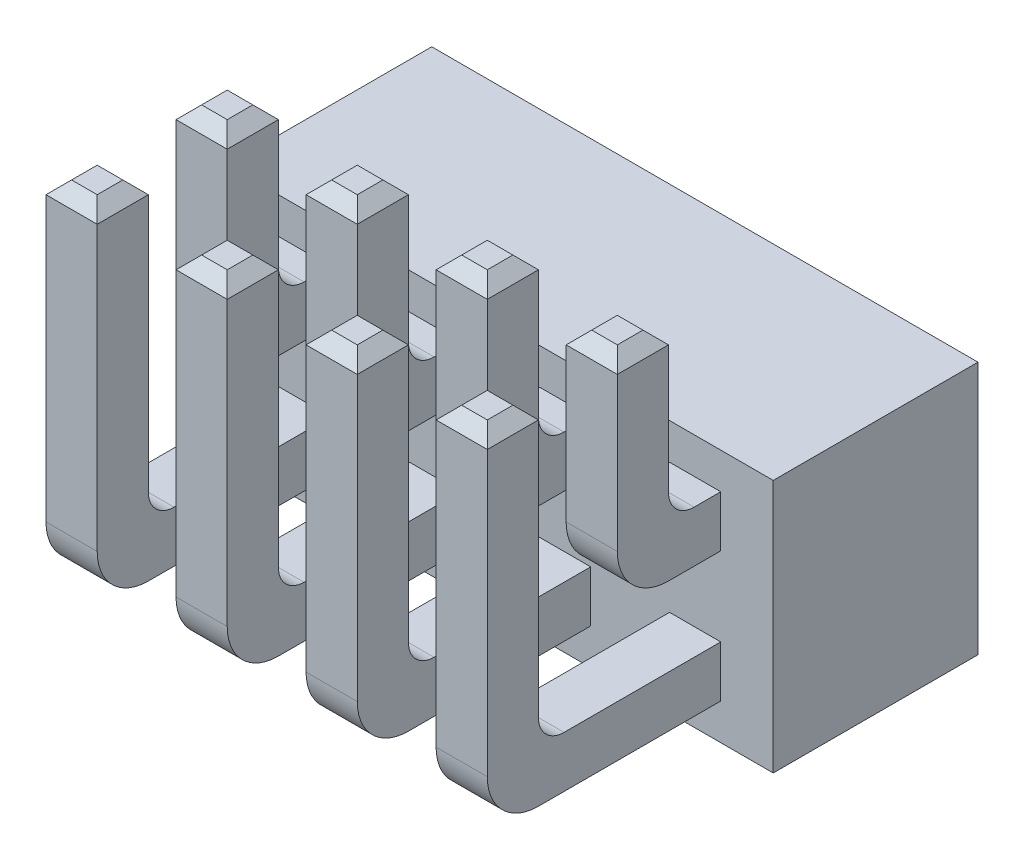
from build123d import *

# Parameters (mm, degrees)
SKETCH1_W           = 10.67
SKETCH1_H           = 4.95
BOSS_EXTRUDE1_DEPTH = 4
SKETCH3_W           = 1.382324252
SKETCH3_H           = 1.382324252
CUT_EXTRUDE1_DEPTH  = 3
BOSS_EXTRUDE2_START = 3.31
BOSS_EXTRUDE2_DEPTH = 1
LPATTERN1_COUNT     = 4
LPATTERN1_PITCH     = 2.54
CHAMFER1_SIZE       = 0.25


with BuildPart() as part:
    # Sketch1 → Boss-Extrude1 (new body)
    with BuildSketch(Plane.XY):
        Rectangle(SKETCH1_W, SKETCH1_H)
    extrude(amount=BOSS_EXTRUDE1_DEPTH)

    # Sketch3 → Cut-Extrude1 (cut)
    with BuildSketch(Plane(origin=(0, 0, 0), x_dir=(-1, 0, 0), z_dir=(0, 0, -1))):
        with Locations((-1.27, 1.27)):
            Rectangle(SKETCH3_W, SKETCH3_H)
        with Locations((-3.81, 1.27)):
            Rectangle(SKETCH3_W, SKETCH3_H)
        with Locations((1.27, 1.27)):
            Rectangle(SKETCH3_W, SKETCH3_H)
        with Locations((3.81, 1.27)):
            Rectangle(SKETCH3_W, SKETCH3_H)
        with Locations((-1.27, -1.27)):
            Rectangle(SKETCH3_W, SKETCH3_H)
        with Locations((1.27, -1.27)):
            Rectangle(SKETCH3_W, SKETCH3_H)
        with Locations((3.81, -1.27)):
            Rectangle(SKETCH3_W, SKETCH3_H)
        with Locations((-3.81, -1.27)):
            Rectangle(SKETCH3_W, SKETCH3_H)
    extrude(amount=-CUT_EXTRUDE1_DEPTH, mode=Mode.SUBTRACT)

    # Sketch4 → Boss-Extrude2 (add)
    with BuildSketch(Plane(origin=(0, 0, 0), x_dir=(0, 0, -1), z_dir=(1, 0, 0)).offset(BOSS_EXTRUDE2_START)):
        with BuildLine():
            Line((-4, 0.77), (-5.02, 0.77))
            ThreePointArc((-5.02, 0.77), (-5.727106781, 1.062893219), (-6.02, 1.77))
            Line((-6.02, 1.77), (-6.02, 5.015))
            Line((-6.02, 5.015), (-5.02, 5.015))
            Line((-5.02, 5.015), (-5.02, 2.27))
            ThreePointArc((-5.02, 2.27), (-4.873553391, 1.916446609), (-4.52, 1.77))
            Line((-4.52, 1.77), (-4, 1.77))
            Line((-4, 1.77), (-4, 0.77))
        make_face()
        with BuildLine():
            Line((-4, -1.77), (-7.56, -1.77))
            ThreePointArc((-7.56, -1.77), (-8.267106781, -1.477106781), (-8.56, -0.77))
            Line((-8.56, -0.77), (-8.56, 5.015))
            Line((-8.56, 5.015), (-7.56, 5.015))
            Line((-7.56, 5.015), (-7.56, -0.27))
            ThreePointArc((-7.56, -0.27), (-7.413553391, -0.623553391), (-7.06, -0.77))
            Line((-7.06, -0.77), (-4, -0.77))
            Line((-4, -0.77), (-4, -1.77))
        make_face()
    boss_extrude2 = extrude(amount=BOSS_EXTRUDE2_DEPTH)

    # LPattern1: Boss-Extrude2 ×4
    with Locations(*[(-i * LPATTERN1_PITCH, 0, 0) for i in range(1, LPATTERN1_COUNT)]):
        add(boss_extrude2)

    # Chamfer1
    chamfer1_edges = [part.edges().sort_by_distance(p)[0] for p in [
        (-3.81, 5.015, 7.56),
        (-3.31, 5.015, 8.06),
        (-3.81, 5.015, 8.56),
        (-4.31, 5.015, 8.06),
        (-1.27, 5.015, 7.56),
        (-0.77, 5.015, 8.06),
        (-1.27, 5.015, 8.56),
        (-1.77, 5.015, 8.06),
        (1.27, 5.015, 7.56),
        (1.77, 5.015, 8.06),
        (1.27, 5.015, 8.56),
        (0.77, 5.015, 8.06),
        (3.81, 5.015, 7.56),
        (4.31, 5.015, 8.06),
        (3.81, 5.015, 8.56),
        (3.31, 5.015, 8.06),
        (3.81, 5.015, 5.02),
        (4.31, 5.015, 5.52),
        (3.81, 5.015, 6.02),
        (3.31, 5.015, 5.52),
        (1.27, 5.015, 5.02),
        (1.77, 5.015, 5.52),
        (1.27, 5.015, 6.02),
        (0.77, 5.015, 5.52),
        (-1.27, 5.015, 5.02),
        (-0.77, 5.015, 5.52),
        (-1.27, 5.015, 6.02),
        (-1.77, 5.015, 5.52),
        (-3.81, 5.015, 5.02),
        (-3.31, 5.015, 5.52),
        (-3.81, 5.015, 6.02),
        (-4.31, 5.015, 5.52),
    ]]
    chamfer(chamfer1_edges, length=CHAMFER1_SIZE)


solid = part.part
